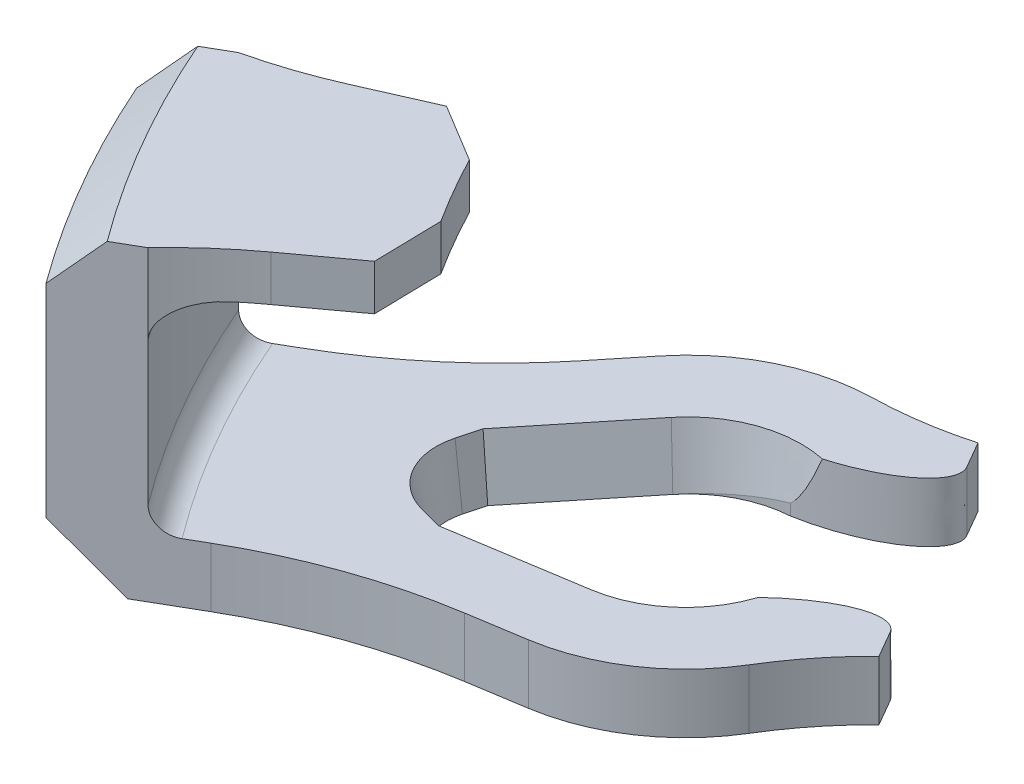
from build123d import *

# Parameters (mm, degrees)
EXTRUDE_1_DEPTH     = 2.4
EXTRUDE_1_DRAFT     = 10
EXTRUDE_2_DEPTH     = 12.4
EXTRUDE_4_DEPTH     = 2.4
EXTRUDE_START       = -1.84
EXTRUDE_3_DEPTH     = 1.84
CHAMFER_1_SIZE      = 2.4
FILLET_3_R          = 1
FILLET_4_R          = 19
CHAMFER_2_SIZE      = 1.5
CHAMFER_3_SIZE      = 1.5
FILLET_5_SIZE       = 2.4
FILLET_5_SIZE_2     = 1.4
FILLET_8_R          = 15
CUT_EXTRUDE_2_DEPTH = 5
FILLET_6_DEPTH      = 2.4
FILLET_7_DEPTH      = 2.4
CHAMFER_4_SIZE      = 1.8
FILLET_9_R          = 22


with BuildPart() as part:
    # 草图1 → 凸台-拉伸1 (with draft: the straight prism first)
    with BuildSketch(Plane(origin=(0, 0, 0), x_dir=(1, 0, 0), z_dir=(0, 1, 0))):
        with BuildLine():
            Line((-8, -10.392304845), (-13, -1.732050808))
            Line((-13, -1.732050808), (-21.967816979, -6.909622355))
            Line((-21.967816979, -6.909622355), (-22.707395472, -6.711455524))
            ThreePointArc((-22.707395472, -6.711455524), (-27.045667208, -6.825066474), (-30.622176838, -9.283132374))
            Line((-30.622176838, -9.283132374), (-34.43427487, -13.990668154))
            Line((-34.43427487, -13.990668154), (-34.611399325, -14.209398026))
            Line((-34.611399325, -14.209398026), (-39.758714523, -17.181201841))
            ThreePointArc((-39.758714523, -17.181201841), (-37.509489571, -21.656113901), (-34.758714523, -25.841455878))
            Line((-34.758714523, -25.841455878), (-29.611399325, -22.869652063))
            Line((-29.611399325, -22.869652063), (-29.333411472, -22.825622721))
            Line((-29.333411472, -22.825622721), (-23.350516885, -21.878016874))
            ThreePointArc((-23.350516885, -21.878016874), (-19.433514554, -20.009701627), (-17.165988715, -16.309453567))
            Line((-17.165988715, -16.309453567), (-16.967816979, -15.569876393))
            Line((-16.967816979, -15.569876393), (-8, -10.392304845))
        make_face()
        with BuildLine():
            Line((-27.917710858, -11.473169763), (-31.264303283, -15.605855609))
            Line((-31.264303283, -15.605855609), (-31.480162481, -16.411447438))
            ThreePointArc((-31.480162481, -16.411447438), (-31.264379417, -18.05049777), (-29.952811807, -19.056896659))
            Line((-29.952811807, -19.056896659), (-29.147219046, -19.27275307))
            Line((-29.147219046, -19.27275307), (-23.894912088, -18.440861966))
            ThreePointArc((-23.894912088, -18.440861966), (-21.762087, -17.423555776), (-20.527408298, -15.408754734))
            Line((-20.527408298, -15.408754734), (-19.958845574, -13.286877913))
            ThreePointArc((-19.958845574, -13.286877913), (-20.174626779, -11.647826039), (-21.486196869, -10.641428268))
            Line((-21.486196869, -10.641428268), (-23.608077089, -10.07287972))
            ThreePointArc((-23.608077089, -10.07287972), (-25.97028529, -10.134742248), (-27.917710858, -11.473169763))
        make_face(mode=Mode.SUBTRACT)
    extrude(amount=EXTRUDE_1_DEPTH)
    # 凸台-拉伸1: the draft: its side faces are tilted about the plane it starts from
    extrude_1_sides = [part.faces().sort_by_distance(p)[0] for p in [
        (-26.480958105, 1.2, 22.373834469),
        (-29.59100707, 1.2, 13.539512686),
        (-31.372232882, 1.2, 16.008651523),
        (-31.264379417, 1.2, 18.05049777),
        (-29.550015427, 1.2, 19.164824864),
        (-26.521065567, 1.2, 18.856807518),
        (-21.762087, 1.2, 17.423555776),
        (-20.243126936, 1.2, 14.347816323),
        (-20.174626779, 1.2, 11.647826039),
        (-22.547136979, 1.2, 10.357153994),
        (-25.97028529, 1.2, 10.134742248),
        (-37.509489571, 1.2, 21.656113901),
        (-37.185056924, 1.2, 15.695299933),
        (-32.616788082, 1.2, 11.7462652),
        (-27.045667208, 1.2, 6.825066474),
        (-22.337606226, 1.2, 6.810538939),
        (-17.48390849, 1.2, 4.320836581),
        (-10.5, 1.2, 6.062177826),
        (-12.48390849, 1.2, 12.981090619),
        (-17.066902847, 1.2, 15.93966498),
        (-32.185056924, 1.2, 24.355553971),
        (-19.433514554, 1.2, 20.009701627),
    ]]
    draft(extrude_1_sides, Plane(origin=(0, 0, 0), x_dir=(1, 0, 0), z_dir=(0, 1, 0)), EXTRUDE_1_DRAFT)



with BuildPart() as body_2:
    # 草图3 → 凸台-拉伸2 (new body)
    with BuildSketch(Plane.XZ):
        with BuildLine():
            Line((-34.758714523, 25.841455878), (-37.373134226, 27.350891798))
            ThreePointArc((-37.373134226, 27.350891798), (-40.107565783, 23.156113901), (-42.373134226, 18.69063776))
            Line((-42.373134226, 18.69063776), (-39.758714523, 17.181201841))
            ThreePointArc((-39.758714523, 17.181201841), (-37.509489571, 21.656113901), (-34.758714523, 25.841455878))
        make_face()
    extrude(amount=-EXTRUDE_2_DEPTH)


with BuildPart() as part_1:
    add(part.part)

    add(body_2.part)  # 凸台-拉伸4 merges body 2
    # 草图2 → 凸台-拉伸4 (add)
    with BuildSketch(Plane.XZ):
        with BuildLine():
            Line((-13, 1.732050808), (-8, 10.392304845))
            Line((-8, 10.392304845), (-16.967816979, 15.569876393))
            Line((-16.967816979, 15.569876393), (-17.165988715, 16.309453567))
            ThreePointArc((-17.165988715, 16.309453567), (-19.433514554, 20.009701627), (-23.350516885, 21.878016874))
            Line((-23.350516885, 21.878016874), (-29.611399325, 22.869652063))
            Line((-29.611399325, 22.869652063), (-34.758714523, 25.841455878))
            ThreePointArc((-34.758714523, 25.841455878), (-37.509489571, 21.656113901), (-39.758714523, 17.181201841))
            Line((-39.758714523, 17.181201841), (-34.611399325, 14.209398026))
            Line((-34.611399325, 14.209398026), (-30.622176838, 9.283132374))
            ThreePointArc((-30.622176838, 9.283132374), (-27.045667208, 6.825066474), (-22.707395472, 6.711455524))
            Line((-22.707395472, 6.711455524), (-21.967816979, 6.909622355))
            Line((-21.967816979, 6.909622355), (-13, 1.732050808))
        make_face()
        Polygon((-28.267922288, 9.695660603), (-32.994912051, 15.569876392), (-31.812956682, 19.594100966), (-26.346816011, 20.919608689), (-19.040272004, 17.121163853), (-18.489608424, 9.956624946), (-26.72941961, 8.295337377), align=None, mode=Mode.SUBTRACT)
    extrude(amount=-EXTRUDE_4_DEPTH)

    # 草图4 → 凸台-拉伸3 (add)
    with BuildSketch(Plane(origin=(0, 12.4, 0), x_dir=(1, 0, 0), z_dir=(0, 1, 0)).offset(EXTRUDE_START)):
        with BuildLine():
            Line((-32.308740898, -14.251269906), (-42.373134226, -18.69063776))
            ThreePointArc((-42.373134226, -18.69063776), (-40.107565783, -23.156113901), (-37.373134226, -27.350891798))
            Line((-37.373134226, -27.350891798), (-28.496332224, -20.854555429))
            ThreePointArc((-28.496332224, -20.854555429), (-30.581286341, -17.656113901), (-32.308740898, -14.251269906))
        make_face()
    extrude(amount=EXTRUDE_3_DEPTH)

    # 倒角1
    chamfer_1_edges = [part_1.edges().sort_by_distance(p)[0] for p in [
        (-40.107565783, 0, 23.156113901),
    ]]
    chamfer(chamfer_1_edges, length=CHAMFER_1_SIZE)

    # 圆角3
    fillet_3_edges = [part_1.edges().sort_by_distance(p)[0] for p in [
        (-37.509489571, 2.4, 21.656113901),
    ]]
    fillet(fillet_3_edges, radius=FILLET_3_R)

    # 圆角4
    # the kernel refuses this fillet: 19 mm, written as the material it adds along each edge
    with BuildSketch(Plane(origin=(-34.952188225, 12.4, 25.579163697), x_dir=(0.5936081582817637, 0, 0.8047542198841411), z_dir=(0, -1, 0))) as fillet_4_piece_1:
        with BuildLine():
            CenterArc((19.013054585, -3.433847914), FILLET_4_R, 169.587784597, 10.627793791)
            Line((0.013189074, -3.505336246), (0, 0))
            ThreePointArc((0, 0), (0.162964154, 0.000306581), (0.325928308, 0))
        make_face()
    extrude(amount=1.84)
    with BuildSketch(Plane(origin=(-39.628299682, 12.4, 17.479901072), x_dir=(-0.4001335190817456, 0, -0.9164568549076701), z_dir=(0, -1, 0))) as fillet_4_piece_2:
        with BuildLine():
            CenterArc((19.013054585, 3.433847914), FILLET_4_R, 179.784421612, 10.627793791)
            Line((0.013189074, 3.505336246), (0, 0))
            ThreePointArc((0, 0), (0.162964154, -0.000306581), (0.325928308, 0))
        make_face()
    extrude(amount=1.84)

    # 倒角2
    # the kernel refuses this chamfer: 2.14222201, 1.5 mm, written as the material it takes off along each edge
    with BuildSketch(Plane(origin=(-32.308740898, 4.766259481, 14.251269906), x_dir=(-0.9149448479771033, 0, 0.40357889583098305), z_dir=(0, 1, 0))) as chamfer_2_piece_1:
        with BuildLine():
            Line((CHAMFER_2_SIZE, 0), (-0.071382965, 2.24416745))
            ThreePointArc((-0.071382965, 2.24416745), (-0.019009883, 1.158534109), (0, 0))
            Line((0, 0), (CHAMFER_2_SIZE, 0))
        make_face()
    extrude(amount=13.427481039, mode=Mode.SUBTRACT)

    # 倒角3
    # the kernel refuses this chamfer: 2.14222201, 1.5 mm, written as the material it takes off along each edge
    with BuildSketch(Plane(origin=(-28.496332224, 4.766259481, 20.854555429), x_dir=(-0.564621815428285, 0, -0.8253497474055879), z_dir=(0, 1, 0))) as chamfer_3_piece_1:
        with BuildLine():
            Line((2.245302445, 0), (-CHAMFER_3_SIZE * 0.0317921380924, CHAMFER_3_SIZE * 0.999494502214))
            Line((-CHAMFER_3_SIZE * 0.0317921380924, CHAMFER_3_SIZE * 0.999494502214), (0, 0))
            ThreePointArc((0, 0), (1.158552838, 0.017832003), (2.245302445, 0))
        make_face()
    extrude(amount=13.427481039, mode=Mode.SUBTRACT)

    # 圆角5
    # a fillet whose section is not a circle: 2.4, 1.4 mm, written as the material it adds along each edge
    with BuildSketch(Plane(origin=(-2e-09, 10.56, 2e-09), x_dir=(-0.7124395855651336, 0, 0.7017334514755447), z_dir=(0.7017334514755447, 0, 0.7124395855651336))) as fillet_5_piece_1_section:
        with BuildLine():
            Bezier((43.3122278 - FILLET_5_SIZE, 0), (43.3122278, 0), (43.3122278, FILLET_5_SIZE_2), weights=[1, 0.707106781, 1])
            Line((43.3122278, FILLET_5_SIZE_2), (43.3122278, 0))
            Line((43.3122278, 0), (43.3122278 - FILLET_5_SIZE, 0))
        make_face()
    fillet_5_piece_1 = revolve(axis=Axis((-2e-09, 10.56, 2e-09), (0, -1, 0)), revolution_arc=20.76414098, mode=Mode.PRIVATE)
    fillet_5_piece_1 = fillet_5_piece_1 - Plane(origin=(-20.90248031, 10.56, 38.841639471), x_dir=(0.5936081582819842, 0, 0.8047542198839785), z_dir=(0, 1, 0)) * Cylinder(19, 174, mode=Mode.PRIVATE)
    fillet_5_piece_1 = split(fillet_5_piece_1, bisect_by=Plane(origin=(2.499999998, 10.56, 4.33012702), z_dir=(-0.5000000000000001, 0, -0.8660254037844386)), keep=Keep.TOP, mode=Mode.PRIVATE)
    add(fillet_5_piece_1)
    with BuildSketch(Plane(origin=(-3e-09, 10.56, 1e-09), x_dir=(-0.9149448479769536, 0, 0.4035788958313223), z_dir=(0.4035788958313223, 0, 0.9149448479769536))) as fillet_5_piece_2_section:
        with BuildLine():
            Bezier((43.3122278 - FILLET_5_SIZE, 0), (43.3122278, 0), (43.3122278, FILLET_5_SIZE_2), weights=[1, 0.707106781, 1])
            Line((43.3122278, FILLET_5_SIZE_2), (43.3122278, 0))
            Line((43.3122278, 0), (43.3122278 - FILLET_5_SIZE, 0))
        make_face()
    fillet_5_piece_2 = revolve(axis=Axis((-3e-09, 10.56, 1e-09), (0, -1, 0)), revolution_arc=8.368284413, mode=Mode.PRIVATE)
    fillet_5_piece_2 = fillet_5_piece_2 - Plane(origin=(-44.089086662, 10.56, -1.318740785), x_dir=(-0.4001335190818383, 0, -0.9164568549076296), z_dir=(0, 1, 0)) * Cylinder(19, 174, mode=Mode.PRIVATE)
    fillet_5_piece_2 = split(fillet_5_piece_2, bisect_by=Plane(origin=(-2.500000002, 10.56, -4.330127018), z_dir=(0.4999999999999988, 0, 0.8660254037844394)), keep=Keep.TOP, mode=Mode.PRIVATE)
    add(fillet_5_piece_2)

    # 圆角8
    fillet_8_edges = [part_1.edges().sort_by_distance(p)[0] for p in [
        (-16.967816979, 1.2, 15.569876393),
        (-21.967816979, 1.2, 6.909622355),
    ]]
    fillet(fillet_8_edges, radius=FILLET_8_R)

    # 草图5 → 切除-拉伸2 (cut)
    with BuildSketch(Plane.XZ):
        with BuildLine():
            Line((-29.147219046, 19.27275307), (-31.264303283, 15.605855609))
            Line((-31.264303283, 15.605855609), (-27.917710858, 11.473169763))
            ThreePointArc((-27.917710858, 11.473169763), (-26.519580592, 10.33421548), (-24.781854923, 9.852245982))
            ThreePointArc((-24.781854923, 9.852245982), (-22.061802465, 9.586923289), (-19.411053684, 8.921632073))
            Line((-19.411053684, 8.921632073), (-21.155274081, 5.900553727))
            Line((-21.155274081, 5.900553727), (-15.208253994, -4.420406035))
            Line((-15.208253994, -4.420406035), (0.192169605, 10.177783302))
            Line((0.192169605, 10.177783302), (-15.687666464, 15.370727914))
            Line((-15.687666464, 15.370727914), (-17.431886861, 12.349649567))
            ThreePointArc((-17.431886861, 12.349649567), (-19.333420345, 14.312619743), (-20.923222766, 16.535592924))
            ThreePointArc((-20.923222766, 16.535592924), (-22.209483528, 17.799522767), (-23.894912088, 18.440861966))
            Line((-23.894912088, 18.440861966), (-29.147219046, 19.27275307))
        make_face()
    extrude(amount=-CUT_EXTRUDE_2_DEPTH, mode=Mode.SUBTRACT)

    # 圆角6: read off the stored shape, not the designer's step
    # 圆角6 outline → 圆角6 (cut)
    with BuildSketch(Plane(origin=(0, 0, 0), x_dir=(1, 0, 0), z_dir=(0, 1, 0))):
        with BuildLine():
            Line((-19.411053684, -8.921632073), (-20.538770468, -6.968369307))
            add(Edge.make_bspline(
                [(-20.538770468, -6.968369307), (-19.421581423, -8.903397494), (-24.781854923, -9.852245982)],
                knots=[0, 0, 0, 1, 1, 1], degree=2, weights=[1, 0.573849647, 1]))
            ThreePointArc((-24.781854923, -9.852245982), (-22.061802466, -9.586923289), (-19.411053684, -8.921632073))
        make_face()
    extrude(amount=FILLET_6_DEPTH, mode=Mode.SUBTRACT)

    # 圆角7: read off the stored shape, not the designer's step
    # 圆角7 outline → 圆角7 (cut)
    with BuildSketch(Plane(origin=(0, 0, 0), x_dir=(1, 0, 0), z_dir=(0, 1, 0))):
        with BuildLine():
            ThreePointArc((-17.431886861, -12.349649567), (-19.333420346, -14.312619744), (-20.923222767, -16.535592926))
            add(Edge.make_bspline(
                [(-20.923222767, -16.535592926), (-17.421359117, -12.367884155), (-16.304170077, -14.302912333)],
                knots=[0, 0, 0, 1, 1, 1], degree=2, weights=[1, 0.573849648, 1]))
            Line((-16.304170077, -14.302912333), (-17.431886861, -12.349649567))
        make_face()
    extrude(amount=FILLET_7_DEPTH, mode=Mode.SUBTRACT)

    # 倒角4
    chamfer_4_edges = [part_1.edges().sort_by_distance(p)[0] for p in [
        (-40.107565783, 12.4, 23.156113901),
    ]]
    chamfer(chamfer_4_edges, length=CHAMFER_4_SIZE)

    # 圆角9
    fillet_9_edges = [part_1.edges().sort_by_distance(p)[0] for p in [
        (-34.611399325, 1.2, 14.209398026),
        (-29.611399325, 1.2, 22.869652063),
    ]]
    fillet(fillet_9_edges, radius=FILLET_9_R)


solid = part_1.part
